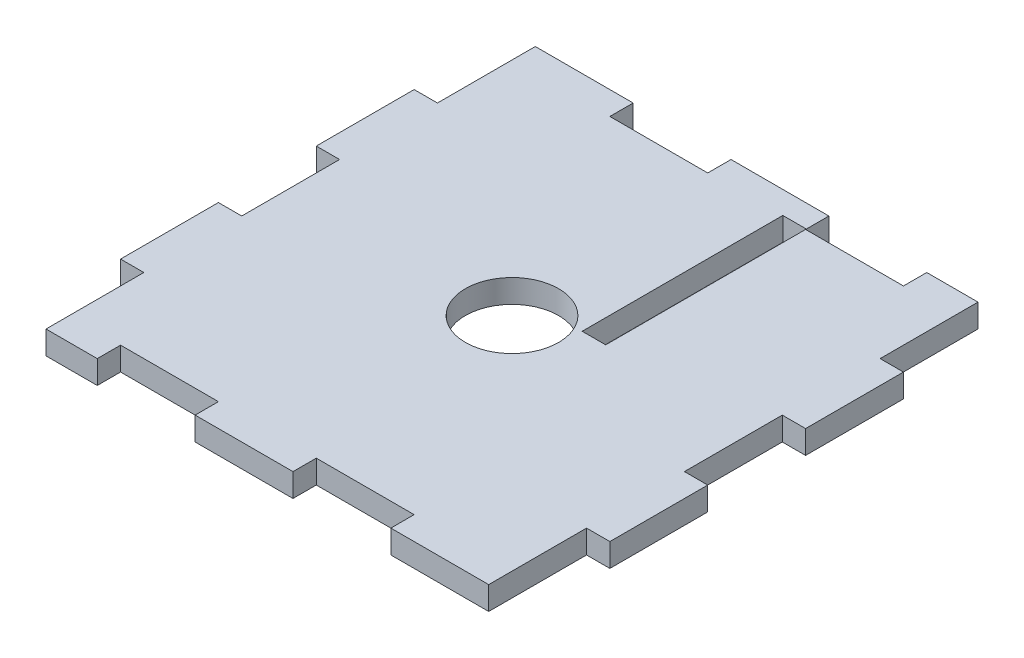
from build123d import *

# Parameters (mm, degrees)
BOSS_EXTRUDE1_DEPTH = 4.7625
SKETCH3_R           = 9.525
CUT_EXTRUDE1_DEPTH  = 4.7625


with BuildPart() as part:
    # Sketch2 → Boss-Extrude1 (new body)
    with BuildSketch(Plane(origin=(0, 100, 0), x_dir=(1, 0, 0), z_dir=(0, 1, 0))):
        Polygon((40, 100), (40, 95.2375), (20, 95.2375), (20, 100), (0, 100), (0, 80), (-4.7625, 80), (-4.7625, 60), (0, 60), (0, 40), (-4.7625, 40), (-4.7625, 20), (0, 20), (0, 0), (10.475, 0), (10.475, 4.7625), (30.475, 4.7625), (30.475, 0), (50.475, 0), (50.475, 4.7625), (70.475, 4.7625), (70.475, 0), (90.475, 0), (90.475, 20), (95.2375, 20), (95.2375, 40), (90.475, 40), (90.475, 60), (95.2375, 60), (95.2375, 80), (90.475, 80), (90.475, 100), (80, 100), (80, 95.2375), (60, 95.2375), (60, 54.386875), (55.189875, 54.386875), (55.189875, 95.392875), (60, 95.392875), (60, 100), align=None)
    extrude(amount=-BOSS_EXTRUDE1_DEPTH)

    # Sketch3 → Cut-Extrude1 (cut)
    with BuildSketch(Plane(origin=(0, 100, 0), x_dir=(1, 0, 0), z_dir=(0, 1, 0))):
        with Locations((45.2375, 50)):
            Circle(SKETCH3_R)
    extrude(amount=-CUT_EXTRUDE1_DEPTH, mode=Mode.SUBTRACT)


solid = part.part
